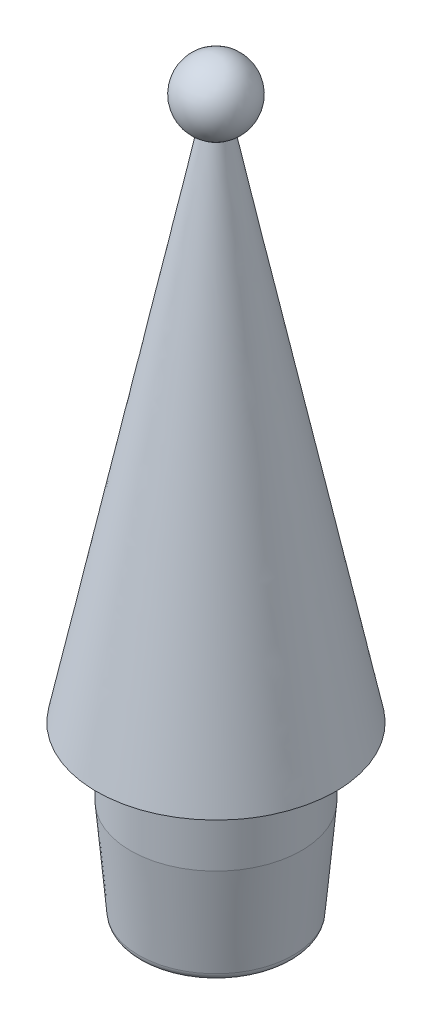
from build123d import *

# Parameters (mm, degrees)
SKETCH1_R           = 2.5
BOSS_EXTRUDE1_DEPTH = 5
SKETCH4_R           = 1.075
CUT_EXTRUDE1_DEPTH  = 13
CHAMFER1_SIZE       = 0.3
CHAMFER1_SIZE2      = 8.590875985
CHAMFER2_SIZE       = 3
CHAMFER2_SIZE2      = 0.262465991
FILLET2_R           = 0.25
FILLET4_R           = 0.25
SKETCH6_R           = 0.55
CUT_EXTRUDE2_DEPTH  = 4
FILLET5_R           = 0.1


with BuildPart() as part:
    # Sketch1 → Boss-Extrude1 (new body)
    with BuildSketch(Plane(origin=(0, 0, 0), x_dir=(1, 0, 0), z_dir=(0, 1, 0))):
        with Locations(Location((0, 0, 0), (0, 0, 270))):
            Circle(SKETCH1_R)
    extrude(amount=BOSS_EXTRUDE1_DEPTH)

    # Loft1: read off the stored shape, not the designer's step
    # Loft1: loft between two sections, ruled curve by curve
    loft1_from = [
        Edge.make_bspline([(-0.353623786, 20, -0.186949774), (0.020275763, 20, -0.894197346), (0.727523334, 20, -0.520297797), (0.353623786, 20, 0.186949774), (-0.020275763, 20, 0.894197346), (-0.727523334, 20, 0.520297797), (-0.353623786, 20, -0.186949774)], [0, 0, 0, 0, 0.5, 0.5, 0.5, 1, 1, 1, 1], 3, [1, 0.333333333, 0.333333333, 1, 0.333333333, 0.333333333, 1]),
    ]
    loft1_to = [
        Edge.make_bspline([(-3.363471416, 5, -0.968018612), (-1.427434193, 5, -7.694961444), (5.299508639, 5, -5.758924221), (3.363471416, 5, 0.968018612), (1.427434193, 5, 7.694961444), (-5.299508639, 5, 5.758924221), (-3.363471416, 5, -0.968018612)], [0, 0, 0, 0, 0.5, 0.5, 0.5, 1, 1, 1, 1], 3, [1, 0.333333333, 0.333333333, 1, 0.333333333, 0.333333333, 1]),
    ]
    loft1 = Solid(Shell([*[Face.make_surface_from_curves(loft1_from[k], loft1_to[k]) for k in range(1)], Face(Wire(loft1_from)), Face(Wire(loft1_to))]))
    add(loft1)

    # Sketch4 → Cut-Extrude1 (cut)
    with BuildSketch(Plane(origin=(0, 0, 0), x_dir=(1, 0, 0), z_dir=(0, 1, 0))):
        with Locations(Location((0, 0, 0), (0, 0, 90))):
            Circle(SKETCH4_R)
    extrude(amount=CUT_EXTRUDE1_DEPTH, mode=Mode.SUBTRACT)

    # Chamfer1
    chamfer1_edges = [part.edges().sort_by_distance(p)[0] for p in [
        (0, 0, 1.075),
    ]]
    chamfer1_side = [part.faces().sort_by_distance(p)[0] for p in [
        (0, 0, -2.429289322),
    ]]
    chamfer(chamfer1_edges, length=CHAMFER1_SIZE, length2=CHAMFER1_SIZE2, reference=chamfer1_side[0])

    # Chamfer2
    chamfer2_edges = [part.edges().sort_by_distance(p)[0] for p in [
        (0, 0, -2.5),
    ]]
    chamfer2_side = [part.faces().sort_by_distance(p)[0] for p in [
        (0, 2.5, -2.5),
    ]]
    chamfer(chamfer2_edges, length=CHAMFER2_SIZE, length2=CHAMFER2_SIZE2, reference=chamfer2_side[0])

    # Fillet2
    fillet2_edges = [part.edges().sort_by_distance(p)[0] for p in [
        (0, 5, -2.5),
    ]]
    fillet(fillet2_edges, radius=FILLET2_R)

    # Fillet4
    fillet4_edges = [part.edges().sort_by_distance(p)[0] for p in [
        (0, 0, 1.375),
        (0, 0, -2.237534009),
    ]]
    fillet(fillet4_edges, radius=FILLET4_R)

    # Sketch5 → Revolve1 (revolve)
    with BuildSketch(Plane.XY):
        with BuildLine():
            Line((0, 21.916515139), (0, 19.916515139))
            ThreePointArc((0, 19.916515139), (-1, 20.916515139), (0, 21.916515139))
        make_face()
    revolve(axis=Axis((0, 24.727188158, 0), (0, -1, 0)))

    # Sketch6 → Cut-Extrude2 (cut)
    with BuildSketch(Plane.XZ.offset(-13)):
        with Locations(Location((0, 0, 0), (0, 0, 270))):
            Circle(SKETCH6_R)
    extrude(amount=-CUT_EXTRUDE2_DEPTH, mode=Mode.SUBTRACT)

    # Fillet5
    fillet5_edges = [part.edges().sort_by_distance(p)[0] for p in [
        (0, 13, 0.55),
    ]]
    fillet(fillet5_edges, radius=FILLET5_R)


solid = part.part
